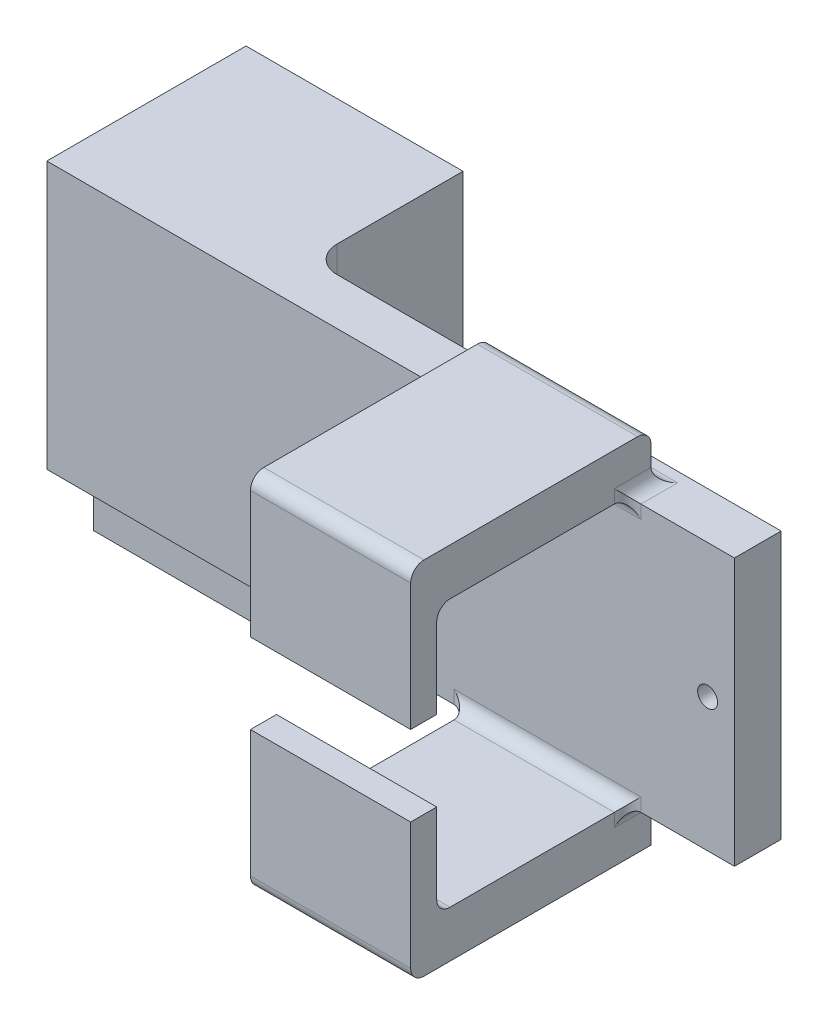
from build123d import *

# Parameters (mm, degrees)
SKETCH1_W           = 51.5
SKETCH1_H           = 20
BOSS_EXTRUDE1_DEPTH = 3.5
SKETCH2_W           = 12
SKETCH2_H           = 18
BOSS_EXTRUDE2_DEPTH = 3.5
FILLET1_R           = 1
FILLET2_R           = 1
SKETCH3_W           = 12
SKETCH3_H           = 18
BOSS_EXTRUDE3_DEPTH = 3.5
FILLET3_R           = 1
FILLET4_R           = 1
FILLET5_R           = 1
FILLET6_R           = 1
FILLET7_R           = 1
FILLET8_R           = 1
FILLET9_R           = 1
FILLET10_R          = 1
FILLET11_R          = 1
FILLET12_R          = 1
SKETCH4_W           = 12
SKETCH4_H           = 1.95
BOSS_EXTRUDE4_DEPTH = 7
SKETCH5_W           = 12
SKETCH5_H           = 1.95
BOSS_EXTRUDE5_DEPTH = 7
FILLET13_R          = 1
FILLET14_R          = 1
FILLET15_R          = 1
FILLET16_R          = 1
FILLET17_R          = 1
SKETCH8_W           = 16.25
SKETCH8_H           = 25.726511914
BOSS_EXTRUDE6_DEPTH = 11.42
FILLET21_R          = 2
FILLET22_R          = 2
FILLET23_R          = 2
SKETCH9_R           = 0.745983734
CUT_EXTRUDE1_DEPTH  = 10
SKETCH10_R          = 0.75
CUT_EXTRUDE2_DEPTH  = 10
SKETCH11_R          = 1.41875541
CUT_EXTRUDE3_DEPTH  = 10
SKETCH12_R          = 1.401780947
CUT_EXTRUDE4_DEPTH  = 10


with BuildPart() as part:
    # Sketch1 → Boss-Extrude1 (new body)
    with BuildSketch(Plane.XY):
        Rectangle(SKETCH1_W, SKETCH1_H)
    extrude(amount=BOSS_EXTRUDE1_DEPTH)

    # Sketch2 → Boss-Extrude2 (add)
    with BuildSketch(Plane(origin=(0, 10, 0), x_dir=(1, 0, 0), z_dir=(0, 1, 0))):
        with Locations((11.75, -10.75)):
            Rectangle(SKETCH2_W, SKETCH2_H)
    extrude(amount=BOSS_EXTRUDE2_DEPTH)

    # Fillet1
    fillet1_edges = [part.edges().sort_by_distance(p)[0] for p in [
        (11.75, 10, 1.75),
    ]]
    fillet(fillet1_edges, radius=FILLET1_R)

    # Fillet2
    fillet2_edges = [part.edges().sort_by_distance(p)[0] for p in [
        (11.75, 10, 3.5),
    ]]
    fillet(fillet2_edges, radius=FILLET2_R)

    # Sketch3 → Boss-Extrude3 (add)
    with BuildSketch(Plane(origin=(0, -10, 0), x_dir=(-1, 0, 0), z_dir=(0, -1, 0))):
        with Locations((-11.75, -10.75)):
            Rectangle(SKETCH3_W, SKETCH3_H)
    extrude(amount=BOSS_EXTRUDE3_DEPTH)

    # Fillet3
    fillet3_edges = [part.edges().sort_by_distance(p)[0] for p in [
        (11.75, -10, 1.75),
    ]]
    fillet(fillet3_edges, radius=FILLET3_R)

    # Fillet4
    fillet4_edges = [part.edges().sort_by_distance(p)[0] for p in [
        (11.75, -10, 3.5),
    ]]
    fillet(fillet4_edges, radius=FILLET4_R)

    # Fillet5
    fillet5_edges = [part.edges().sort_by_distance(p)[0] for p in [
        (17.75, 10, 2.125),
    ]]
    fillet(fillet5_edges, radius=FILLET5_R)

    # Fillet6
    fillet6_edges = [part.edges().sort_by_distance(p)[0] for p in [
        (5.75, 10, 2.125),
    ]]
    fillet(fillet6_edges, radius=FILLET6_R)

    # Fillet7
    fillet7_edges = [part.edges().sort_by_distance(p)[0] for p in [
        (17.75, 10, 3.5),
    ]]
    fillet(fillet7_edges, radius=FILLET7_R)

    # Fillet8
    fillet8_edges = [part.edges().sort_by_distance(p)[0] for p in [
        (5.75, 10, 3.5),
    ]]
    fillet(fillet8_edges, radius=FILLET8_R)

    # Fillet9
    fillet9_edges = [part.edges().sort_by_distance(p)[0] for p in [
        (5.75, -10, 2.125),
    ]]
    fillet(fillet9_edges, radius=FILLET9_R)

    # Fillet10
    fillet10_edges = [part.edges().sort_by_distance(p)[0] for p in [
        (5.75, -10, 3.5),
    ]]
    fillet(fillet10_edges, radius=FILLET10_R)

    # Fillet11
    fillet11_edges = [part.edges().sort_by_distance(p)[0] for p in [
        (17.75, -10, 2.125),
    ]]
    fillet(fillet11_edges, radius=FILLET11_R)

    # Fillet12
    fillet12_edges = [part.edges().sort_by_distance(p)[0] for p in [
        (17.75, -10, 3.5),
    ]]
    fillet(fillet12_edges, radius=FILLET12_R)

    # Sketch4 → Boss-Extrude4 (add)
    with BuildSketch(Plane(origin=(0, -10, 0), x_dir=(1, 0, 0), z_dir=(0, 1, 0))):
        with Locations((11.75, -18.775)):
            Rectangle(SKETCH4_W, SKETCH4_H)
    extrude(amount=BOSS_EXTRUDE4_DEPTH)

    # Sketch5 → Boss-Extrude5 (add)
    with BuildSketch(Plane(origin=(0, 10, 0), x_dir=(-1, 0, 0), z_dir=(0, -1, 0))):
        with Locations((-11.75, -18.775)):
            Rectangle(SKETCH5_W, SKETCH5_H)
    extrude(amount=BOSS_EXTRUDE5_DEPTH)

    # Fillet13
    fillet13_edges = [part.edges().sort_by_distance(p)[0] for p in [
        (11.75, 10, 17.8),
    ]]
    fillet(fillet13_edges, radius=FILLET13_R)

    # Fillet14
    fillet14_edges = [part.edges().sort_by_distance(p)[0] for p in [
        (11.75, 13.5, 19.75),
    ]]
    fillet(fillet14_edges, radius=FILLET14_R)

    # Fillet15
    fillet15_edges = [part.edges().sort_by_distance(p)[0] for p in [
        (11.75, 13.5, 1.75),
    ]]
    fillet(fillet15_edges, radius=FILLET15_R)

    # Fillet16
    fillet16_edges = [part.edges().sort_by_distance(p)[0] for p in [
        (11.75, -13.5, 19.75),
    ]]
    fillet(fillet16_edges, radius=FILLET16_R)

    # Fillet17
    fillet17_edges = [part.edges().sort_by_distance(p)[0] for p in [
        (11.75, -10, 17.8),
    ]]
    fillet(fillet17_edges, radius=FILLET17_R)

    # Sketch8 → Boss-Extrude6 (add)
    with BuildSketch(Plane(origin=(0, 0, 0), x_dir=(-1, 0, 0), z_dir=(0, 0, -1))):
        with Locations((17.625, -2.863255957)):
            Rectangle(SKETCH8_W, SKETCH8_H)
    extrude(amount=BOSS_EXTRUDE6_DEPTH)

    # Fillet21
    fillet21_edges = [part.edges().sort_by_distance(p)[0] for p in [
        (-9.5, 0, 0),
    ]]
    fillet(fillet21_edges, radius=FILLET21_R)

    # Fillet22
    fillet22_edges = [part.edges().sort_by_distance(p)[0] for p in [
        (-17.625, -10, 0),
    ]]
    fillet(fillet22_edges, radius=FILLET22_R)

    # Fillet23
    fillet23_edges = [part.edges().sort_by_distance(p)[0] for p in [
        (-9.5, -10, 0),
    ]]
    fillet(fillet23_edges, radius=FILLET23_R - 0.0001)  # a hair under: the kernel refuses the full size

    # Sketch9 → Cut-Extrude1 (cut)
    with BuildSketch(Plane(origin=(0, 0, 0), x_dir=(-1, 0, 0), z_dir=(0, 0, -1))):
        with Locations((-23.742674676, -0.005014859)):
            Circle(SKETCH9_R)
    extrude(amount=-CUT_EXTRUDE1_DEPTH, mode=Mode.SUBTRACT)

    # Sketch10 → Cut-Extrude2 (cut)
    with BuildSketch(Plane(origin=(0, 0, 0), x_dir=(-1, 0, 0), z_dir=(0, 0, -1))):
        with Locations((-1.39, 0)):
            Circle(SKETCH10_R)
    extrude(amount=-CUT_EXTRUDE2_DEPTH, mode=Mode.SUBTRACT)

    # Sketch11 → Cut-Extrude3 (cut)
    with BuildSketch(Plane(origin=(0, 0, -11.42), x_dir=(-1, 0, 0), z_dir=(0, 0, -1))):
        with Locations((16.518366767, 3.994492079)):
            Circle(SKETCH11_R)
    extrude(amount=-CUT_EXTRUDE3_DEPTH, mode=Mode.SUBTRACT)

    # Sketch12 → Cut-Extrude4 (cut)
    with BuildSketch(Plane(origin=(0, 0, -11.42), x_dir=(-1, 0, 0), z_dir=(0, 0, -1))):
        with Locations((16.50448956, -9.000225668)):
            Circle(SKETCH12_R)
    extrude(amount=-CUT_EXTRUDE4_DEPTH, mode=Mode.SUBTRACT)


solid = part.part
